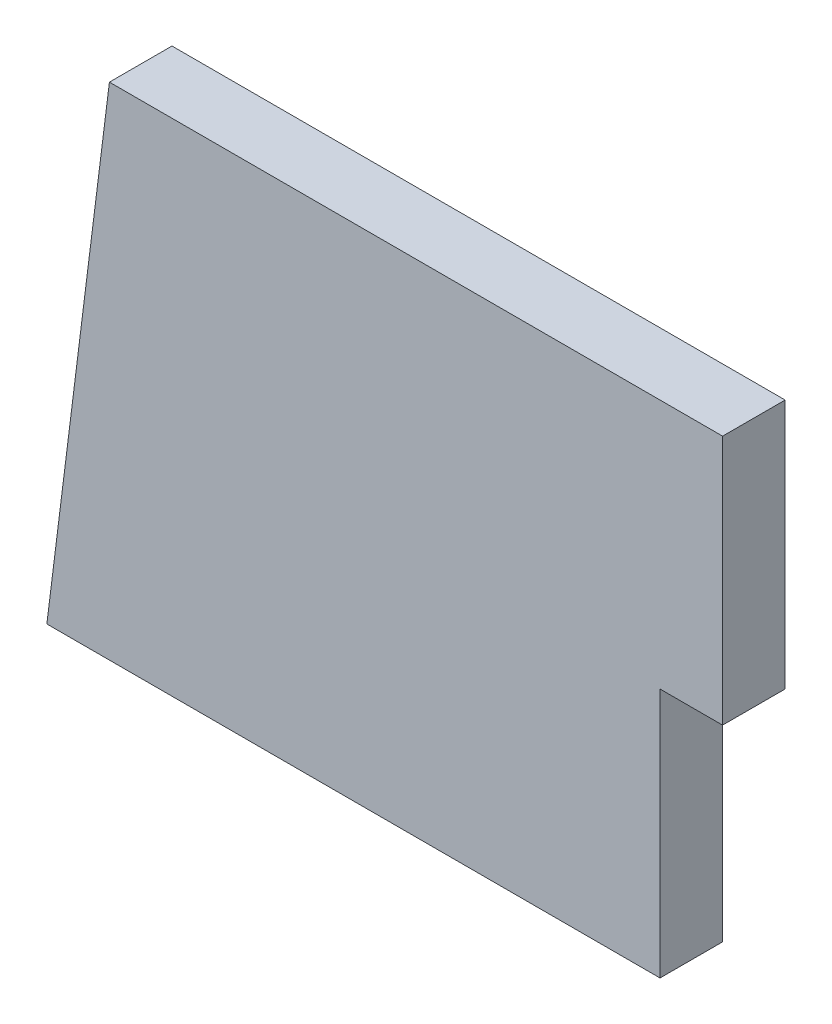
from build123d import *

# Parameters (mm, degrees)
BOSS_EXTRU_1_DEPTH = 5


with BuildPart() as part:
    # Esquisse1 → Boss.-Extru.1 (new body)
    with BuildSketch(Plane.XY):
        Polygon((0, 0), (0, -20), (-5, -20), (-5, -40), (-54, -40), (-49, 0), align=None)
    extrude(amount=BOSS_EXTRU_1_DEPTH)


solid = part.part
